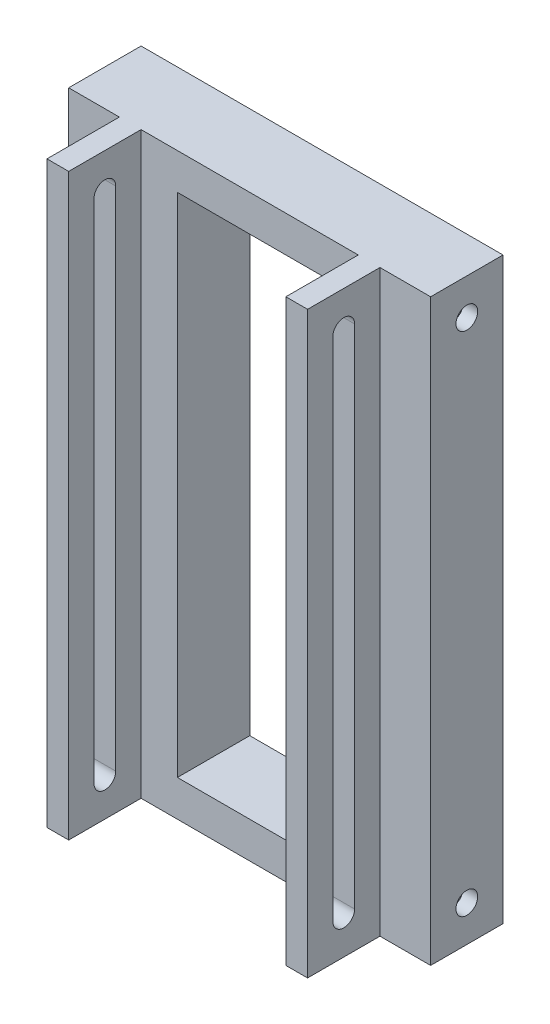
from build123d import *

# Parameters (mm, degrees)
ESQUISSE1_W             = 7
ESQUISSE1_H             = 80
BOSS_EXTRU_1_DEPTH      = 10
ESQUISSE1_W_2           = 30
ESQUISSE1_W_3           = 20
ESQUISSE1_H_2           = 70
BOSS_EXTRU_1_2_DEPTH    = 10
BOSS_EXTRU_1_3_DEPTH    = 10
ESQUISSE1_4_W           = 3
ESQUISSE1_4_H           = 80
BOSS_EXTRU_2_DEPTH      = 20
ENL_V_MAT_EXTRU_1_DEPTH = 68.225072739
ESQUISSE3_R             = 1.5
ENL_V_MAT_EXTRU_2_DEPTH = 2
ENL_V_START             = -2
ESQUISSE4_R             = 1.5
ENL_V_MAT_EXTRU_3_DEPTH = 2


with BuildPart() as part:
    # Esquisse1 → Boss.-Extru.1 (new body)
    with BuildSketch(Plane.XY):
        with Locations((-17.072126901, -7.646725016)):
            Rectangle(ESQUISSE1_W, ESQUISSE1_H)
    extrude(amount=BOSS_EXTRU_1_DEPTH)



with BuildPart() as body_2:
    # Esquisse1 → Boss.-Extru.1 2 (new body)
    with BuildSketch(Plane.XY):
        with Locations((4.427873099, -7.646725016)):
            Rectangle(ESQUISSE1_W_2, ESQUISSE1_H)
        with Locations((4.445587542, -7.646725016)):
            Rectangle(ESQUISSE1_W_3, ESQUISSE1_H_2, mode=Mode.SUBTRACT)
    extrude(amount=BOSS_EXTRU_1_2_DEPTH)


with BuildPart() as body_3:
    # Esquisse1 → Boss.-Extru.1 3 (new body)
    with BuildSketch(Plane.XY):
        with Locations((25.927873099, -7.646725016)):
            Rectangle(ESQUISSE1_W, ESQUISSE1_H)
    extrude(amount=BOSS_EXTRU_1_3_DEPTH)


with BuildPart() as part_1:
    add(part.part)

    add(body_2.part)  # Boss.-Extru.2 merges body 2

    add(body_3.part)  # Boss.-Extru.2 merges body 3
    # Esquisse1<4> → Boss.-Extru.2 (add)
    with BuildSketch(Plane.XY):
        with Locations((-12.072126901, -7.646725016)):
            Rectangle(ESQUISSE1_4_W, ESQUISSE1_4_H)
        with Locations((20.927873099, -7.646725016)):
            Rectangle(ESQUISSE1_4_W, ESQUISSE1_4_H)
    extrude(amount=BOSS_EXTRU_2_DEPTH)

    # Esquisse2 → Enlèv. mat.-Extru.1 (cut, through all)
    with BuildSketch(Plane(origin=(22.427873099, 0, 0), x_dir=(0, 0, -1), z_dir=(1, 0, 0))):
        with BuildLine():
            Line((-16.5, -42.646725016), (-16.5, 27.353274984))
            ThreePointArc((-16.5, 27.353274984), (-15, 28.853274984), (-13.5, 27.353274984))
            Line((-13.5, 27.353274984), (-13.5, -42.646725016))
            ThreePointArc((-13.5, -42.646725016), (-15, -44.146725016), (-16.5, -42.646725016))
        make_face()
    extrude(amount=-ENL_V_MAT_EXTRU_1_DEPTH, mode=Mode.SUBTRACT)

    # Esquisse3 → Enlèv. mat.-Extru.2 (cut)
    with BuildSketch(Plane.ZY.offset(20.572126901)):
        with Locations((5, 27.353274984)):
            Circle(ESQUISSE3_R)
        with Locations((5, -42.646725016)):
            Circle(ESQUISSE3_R)
    extrude(amount=-ENL_V_MAT_EXTRU_2_DEPTH, mode=Mode.SUBTRACT)

    # Esquisse4 → Enlèv. mat.-Extru.3 (cut)
    with BuildSketch(Plane(origin=(29.427873099, 0, 0), x_dir=(0, 0, -1), z_dir=(1, 0, 0)).offset(ENL_V_START)):
        with Locations((-5, -42.646725016)):
            Circle(ESQUISSE4_R)
        with Locations((-5, 27.353274984)):
            Circle(ESQUISSE4_R)
    extrude(amount=ENL_V_MAT_EXTRU_3_DEPTH, mode=Mode.SUBTRACT)


solid = part_1.part
